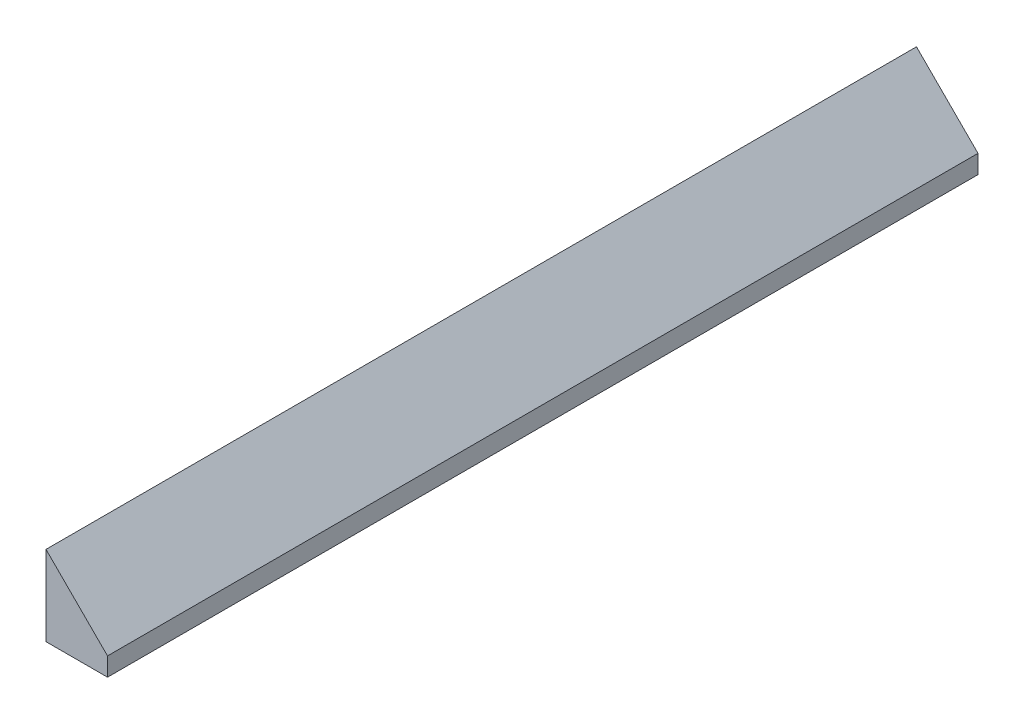
from build123d import *

# Parameters (mm, degrees)
BOSS_EXTRUDE1_DEPTH = 14.15


with BuildPart() as part:
    # Sketch1 → Boss-Extrude1 (new, symmetric)
    with BuildSketch(Plane.XY):
        Polygon((0, 2.6), (0, 0), (2, 0), (2, 0.6), align=None)
    extrude(amount=BOSS_EXTRUDE1_DEPTH, both=True)


solid = part.part
